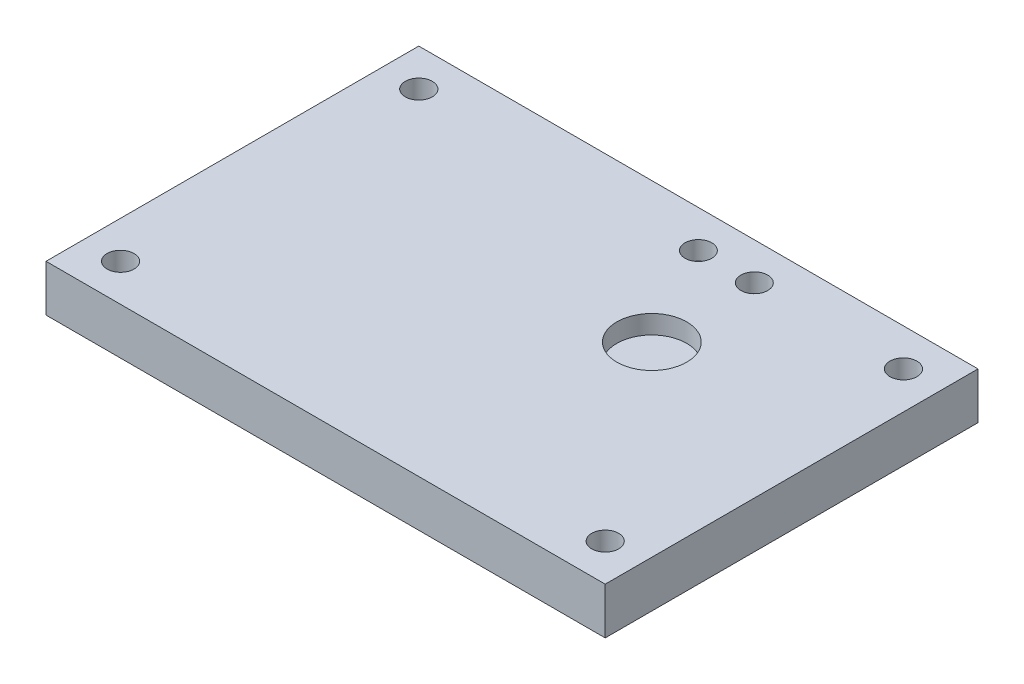
from build123d import *

# Parameters (mm, degrees)
SKETCH1_W           = 76.2
SKETCH1_H           = 50.8
BOSS_EXTRUDE1_DEPTH = 6.35
SKETCH2_R           = 1.8415
CUT_EXTRUDE1_DEPTH  = 47.228697797
SKETCH3_R           = 4.7625
SKETCH3_R_2         = 1.8288
CUT_EXTRUDE2_DEPTH  = 2.54


with BuildPart() as part:
    # Sketch1 → Boss-Extrude1 (new body)
    with BuildSketch(Plane(origin=(0, 0, 0), x_dir=(1, 0, 0), z_dir=(0, 1, 0))):
        Rectangle(SKETCH1_W, SKETCH1_H)
    extrude(amount=BOSS_EXTRUDE1_DEPTH)

    # Sketch2 → Cut-Extrude1 (cut, through all)
    with BuildSketch(Plane(origin=(0, 6.35, 0), x_dir=(1, 0, 0), z_dir=(0, 1, 0))):
        with Locations((-33.02, 20.32)):
            Circle(SKETCH2_R)
        with Locations((-33.02, -20.32)):
            Circle(SKETCH2_R)
        with Locations((33.02, -20.32)):
            Circle(SKETCH2_R)
        with Locations((33.02, 20.32)):
            Circle(SKETCH2_R)
    extrude(amount=-CUT_EXTRUDE1_DEPTH, mode=Mode.SUBTRACT)

    # Sketch3 → Cut-Extrude2 (cut)
    with BuildSketch(Plane(origin=(0, 6.35, 0), x_dir=(1, 0, 0), z_dir=(0, 1, 0))):
        with Locations((12.7, 6.35)):
            Circle(SKETCH3_R)
        with Locations((5.08, 20.32)):
            Circle(SKETCH3_R_2)
        with Locations((12.7, 20.32)):
            Circle(SKETCH3_R_2)
    extrude(amount=-CUT_EXTRUDE2_DEPTH, mode=Mode.SUBTRACT)


solid = part.part
